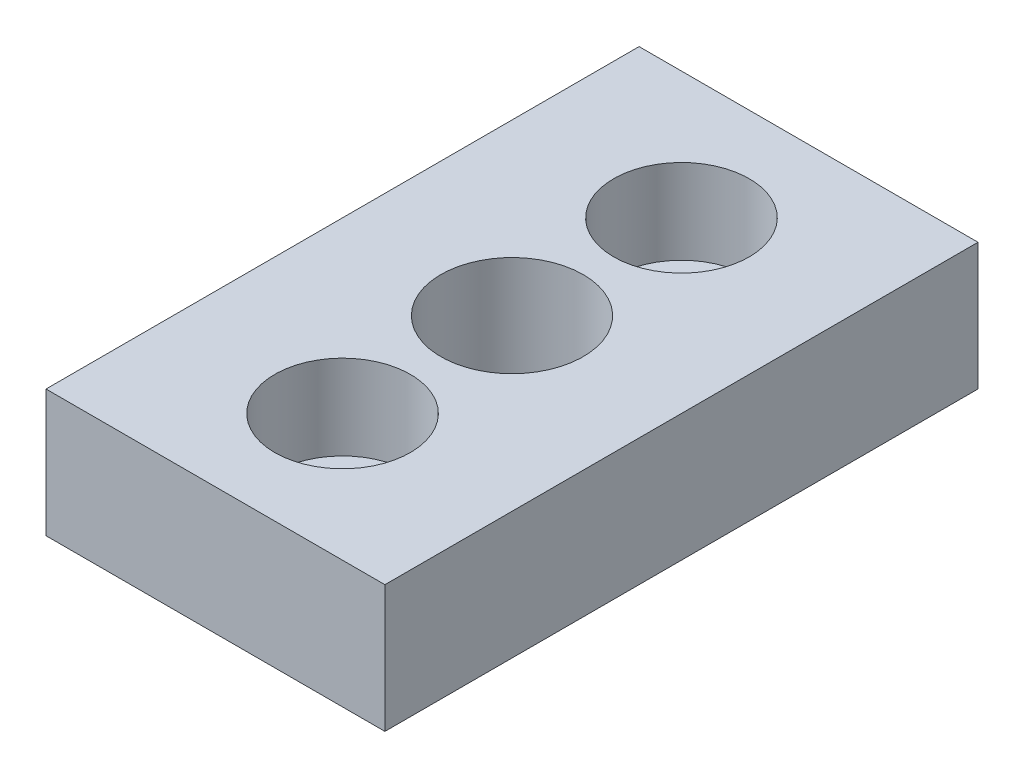
from build123d import *

# Parameters (mm, degrees)
SKETCH1_W           = 20
SKETCH1_H           = 35
BOSS_EXTRUDE1_DEPTH = 7.5
SKETCH3_R           = 4.2
CUT_EXTRUDE1_DEPTH  = 22.505813168
SKETCH5_R           = 2.5
CUT_EXTRUDE2_DEPTH  = 22.505813168
SKETCH6_R           = 4
CUT_EXTRUDE3_DEPTH  = 5


with BuildPart() as part:
    # Sketch1 → Boss-Extrude1 (new body)
    with BuildSketch(Plane(origin=(0, 0, 0), x_dir=(1, 0, 0), z_dir=(0, 1, 0))):
        Rectangle(SKETCH1_W, SKETCH1_H)
    extrude(amount=BOSS_EXTRUDE1_DEPTH)

    # Sketch3 → Cut-Extrude1 (cut, through all)
    with BuildSketch(Plane.XZ):
        Circle(SKETCH3_R)
    extrude(amount=-CUT_EXTRUDE1_DEPTH, mode=Mode.SUBTRACT)

    # Sketch5 → Cut-Extrude2 (cut, through all)
    with BuildSketch(Plane.XZ):
        with Locations((0, 10)):
            Circle(SKETCH5_R)
        with Locations((0, -10)):
            Circle(SKETCH5_R)
    extrude(amount=-CUT_EXTRUDE2_DEPTH, mode=Mode.SUBTRACT)

    # Sketch6 → Cut-Extrude3 (cut)
    with BuildSketch(Plane(origin=(0, 7.5, 0), x_dir=(1, 0, 0), z_dir=(0, 1, 0))):
        with Locations((0, 10)):
            Circle(SKETCH6_R)
        with Locations((0, -10)):
            Circle(SKETCH6_R)
    extrude(amount=-CUT_EXTRUDE3_DEPTH, mode=Mode.SUBTRACT)


solid = part.part
